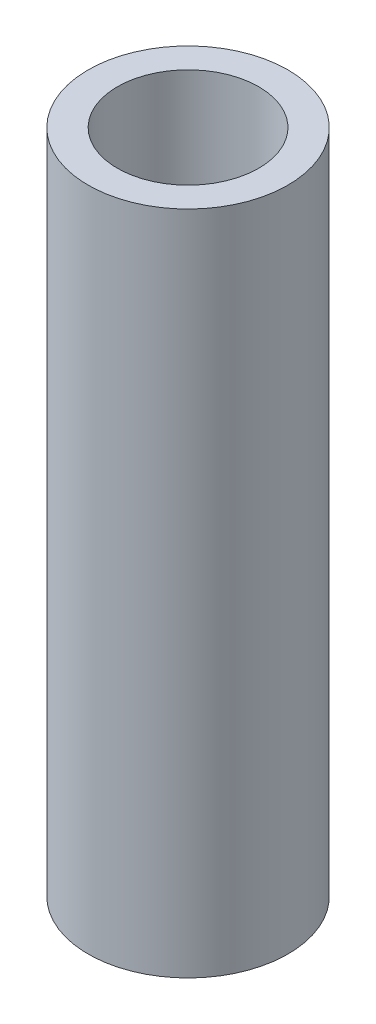
from build123d import *

# Parameters (mm, degrees)
SKETCH1_R           = 8.55
SKETCH1_R_2         = 6.05
EXTRUDE_THIN1_DEPTH = 57


with BuildPart() as part:
    # Sketch1 → Extrude-Thin1 (new body)
    with BuildSketch(Plane(origin=(0, 0, 0), x_dir=(1, 0, 0), z_dir=(0, 1, 0))):
        Circle(SKETCH1_R)
        Circle(SKETCH1_R_2, mode=Mode.SUBTRACT)
    extrude(amount=EXTRUDE_THIN1_DEPTH)


solid = part.part
